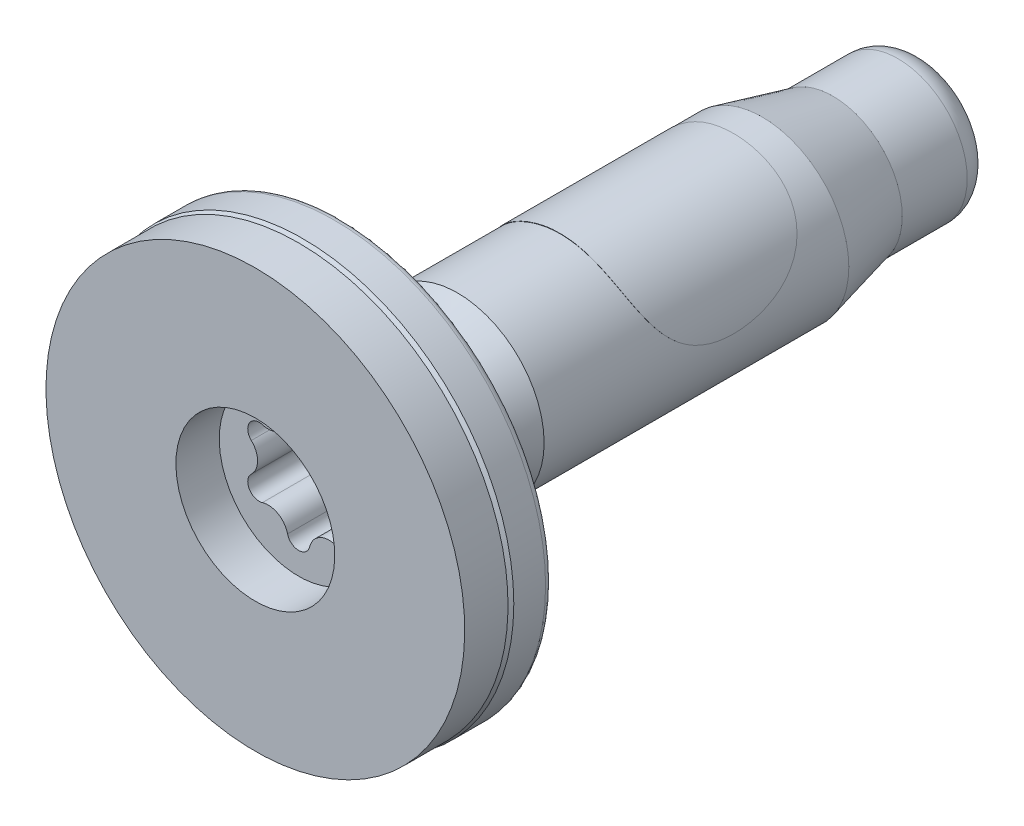
from build123d import *
from build123d.topology import SkipClean

# Parameters (mm, degrees)
SOCKET_CUT_EXTRUDE1_START           = -3.54
SOCKET_CUT_EXTRUDE1_DEPTH           = 3.54
SKETCH13_R                          = 3
LENGTH_BOSS_EXTRUDE1_DEPTH          = 17
SKETCH21_R                          = 2.4
MATPOINT_BOSS_EXTRUDE1_DEPTH        = 3
HEAD_REMOVE_START                   = -4.4
SKETCH59_R                          = 5.5
HEAD_REMOVE_DEPTH                   = 4.4
SMALL_6_LOBE_CUT_START              = -2.55
SMALL_6_LOBE_CUT_DEPTH              = 2.55
F_180_PATCH_EXTRUDE_DEPTH           = 4.5
F_180_PATCH_EXTRUDE_DEPTH_BACK      = 4.5
SKETCH66_R                          = 3
F_180_PATCH_CUT_EXTRUDE_START       = -9.450000865
F_180_PATCH_CUT_EXTRUDE_OUTLINE_R   = 9
F_180_PATCH_CUT_EXTRUDE_OUTLINE_R_2 = 3.010000015
F_180_PATCH_CUT_EXTRUDE_DEPTH       = 6.000000865
SKETCH71_W                          = 1.5
SKETCH71_H                          = 4.5


# Read off the part's stored shape, not the designer's step: 180-patch-Cut-Extrude
with BuildPart() as part:
    # Sketch8 → Head-Revolve1 (revolve)
    with BuildSketch(Plane(origin=(0, 0, 0), x_dir=(0, 0, -1), z_dir=(1, 0, 0))):
        with BuildLine():
            Line((-4.4, 4.75), (-4.4, 2.8))
            Line((-4.4, 2.8), (-4.189927833, 2.016))
            Line((-4.189927833, 2.016), (-4.189927833, 0))
            Line((-4.189927833, 0), (0, 0))
            Line((0, 0), (0, 5))
            Line((0, 5), (-4.15, 5))
            ThreePointArc((-4.15, 5), (-4.326776695, 4.926776695), (-4.4, 4.75))
        make_face()
    revolve(axis=Axis((0, 0, 0), (0, 0, 1)))

    # Sketch9 → socket-Cut-Extrude1 (cut)
    with BuildSketch(Plane.XY.offset(4.4).offset(SOCKET_CUT_EXTRUDE1_START)):
        with BuildLine():
            ThreePointArc((0.544244974, 2.369331508), (1.008, 1.745907214), (1.779778789, 1.655995727))
            ThreePointArc((1.779778789, 1.655995727), (2.424871131, 1.4), (2.324023763, 0.713335781))
            ThreePointArc((2.324023763, 0.713335781), (2.016, 0), (2.324023763, -0.713335781))
            ThreePointArc((2.324023763, -0.713335781), (2.424871131, -1.4), (1.779778789, -1.655995727))
            ThreePointArc((1.779778789, -1.655995727), (1.008, -1.745907214), (0.544244974, -2.369331508))
            ThreePointArc((0.544244974, -2.369331508), (0, -2.8), (-0.544244974, -2.369331508))
            ThreePointArc((-0.544244974, -2.369331508), (-1.008, -1.745907214), (-1.779778789, -1.655995727))
            ThreePointArc((-1.779778789, -1.655995727), (-2.424871131, -1.4), (-2.324023763, -0.713335781))
            ThreePointArc((-2.324023763, -0.713335781), (-2.016, 0), (-2.324023763, 0.713335781))
            ThreePointArc((-2.324023763, 0.713335781), (-2.424871131, 1.4), (-1.779778789, 1.655995727))
            ThreePointArc((-1.779778789, 1.655995727), (-1.008, 1.745907214), (-0.544244974, 2.369331508))
            ThreePointArc((-0.544244974, 2.369331508), (0, 2.8), (0.544244974, 2.369331508))
        make_face()
    extrude(amount=SOCKET_CUT_EXTRUDE1_DEPTH, mode=Mode.SUBTRACT)

    # Sketch12 → Socket-Revolve2 (revolve)
    with BuildSketch(Plane(origin=(0, 0, 0), x_dir=(0, 0, -1), z_dir=(1, 0, 0)), mode=Mode.PRIVATE) as socket_revolve2_sk:
        Polygon((-2.11, 5), (-2.11, 2.8), (-0.86, 0), (0, 0), (0, 5), align=None)
    revolve(socket_revolve2_sk.sketch.rotate(Axis((0, 0, 0), (0, 0, -1)), 90), axis=Axis((0, 0, 0), (0, 0, -1)))

    # Sketch13 → Length-Boss-Extrude1 (add)
    with BuildSketch(Plane.XY):
        Circle(SKETCH13_R)
    extrude(amount=-LENGTH_BOSS_EXTRUDE1_DEPTH)

    # Sketch14 → Runout-Cut-Revolve1 (revolve, cut)
    with BuildSketch(Plane(origin=(0, 0, 0), x_dir=(0, 0, -1), z_dir=(1, 0, 0)), mode=Mode.PRIVATE) as runout_cut_revolve1_sk:
        Polygon((0, 3), (4, 3), (3, 2.675), (0, 2.675), align=None)
    revolve(runout_cut_revolve1_sk.sketch.rotate(Axis((0, 0, 0), (0, 0, -1)), 90), axis=Axis((0, 0, 0), (0, 0, -1)), mode=Mode.SUBTRACT)

    # Sketch15 → Fillet-Revolve3 (revolve)
    with BuildSketch(Plane(origin=(0, 0, 0), x_dir=(0, 0, -1), z_dir=(1, 0, 0)), mode=Mode.PRIVATE) as fillet_revolve3_sk:
        with BuildLine():
            ThreePointArc((0.146390721, 3.0375), (0.536304234, 2.769379359), (1, 2.675))
            Line((1, 2.675), (0, 2.675))
            Line((0, 2.675), (0, 3.4))
            ThreePointArc((0, 3.4), (0.037979272, 3.204528459), (0.146390721, 3.0375))
        make_face()
    revolve(fillet_revolve3_sk.sketch.rotate(Axis((0, 0, 0), (0, 0, -1)), 90), axis=Axis((0, 0, 0), (0, 0, -1)))

    # Sketch16 → Chamfer-Cut-Revolve2 (revolve, cut)
    with BuildSketch(Plane(origin=(0, 0, 0), x_dir=(0, 0, -1), z_dir=(1, 0, 0)), mode=Mode.PRIVATE) as chamfer_cut_revolve2_sk:
        Polygon((17, 3), (16.284947844, 3), (17, 2.4), align=None)
    revolve(chamfer_cut_revolve2_sk.sketch.rotate(Axis((0, 0, 0), (0, 0, -1)), 90), axis=Axis((0, 0, 0), (0, 0, -1)), mode=Mode.SUBTRACT)

    # Sketch21 → matpoint-Boss-Extrude1 (add)
    with BuildSketch(Plane(origin=(0, 0, -17), x_dir=(-1, 0, 0), z_dir=(0, 0, -1))):
        Circle(SKETCH21_R)
    extrude(amount=MATPOINT_BOSS_EXTRUDE1_DEPTH)

    # Sketch22 → matpoint-Cut-Revolve1 (revolve, cut)
    with BuildSketch(Plane(origin=(0, 0, 0), x_dir=(0, 0, -1), z_dir=(1, 0, 0)), mode=Mode.PRIVATE) as matpoint_cut_revolve1_sk:
        with BuildLine():
            Line((20, 2.4), (20, 2))
            ThreePointArc((20, 2), (19.675, 2.29375), (19.25, 2.4))
            Line((19.25, 2.4), (20, 2.4))
        make_face()
        Polygon((17, 3), (14.55, 3), (17, 2.4), align=None)
    revolve(matpoint_cut_revolve1_sk.sketch.rotate(Axis((0, 0, -17), (0, 0, -1)), 90), axis=Axis((0, 0, -17), (0, 0, -1)), mode=Mode.SUBTRACT)

    # Sketch59 → head-remove (cut)
    with BuildSketch(Plane.XY.offset(4.4).offset(HEAD_REMOVE_START)):
        Circle(SKETCH59_R)
    extrude(amount=HEAD_REMOVE_DEPTH, mode=Mode.SUBTRACT)

    # Sketch60 → low-head-Revolve (revolve)
    with BuildSketch(Plane(origin=(0, 0, 0), x_dir=(0, 0, -1), z_dir=(1, 0, 0)), mode=Mode.PRIVATE) as low_head_revolve_sk:
        with BuildLine():
            Line((-1.5, 0), (0, 0))
            Line((0, 0), (0, 7.05))
            ThreePointArc((0, 7.05), (-0.073223305, 7.226776695), (-0.25, 7.3))
            Line((-0.25, 7.3), (-1.35, 7.3))
            Line((-1.35, 7.3), (-1.5, 7.15))
            Line((-1.5, 7.15), (-1.5, 0))
        make_face()
    revolve(low_head_revolve_sk.sketch.rotate(Axis((0, 0, 0), (0, 0, -1)), 90), axis=Axis((0, 0, 0), (0, 0, -1)))

    # Sketch61 → Small-6-lobe-Cut (cut)
    with BuildSketch(Plane.XY.offset(1.5).offset(SMALL_6_LOBE_CUT_START)):
        with BuildLine():
            ThreePointArc((0.38388708, 1.671224903), (0, 1.975), (-0.38388708, 1.671224903))
            ThreePointArc((-0.38388708, 1.671224903), (-0.711, 1.231488124), (-1.255379682, 1.168068415))
            ThreePointArc((-1.255379682, 1.168068415), (-1.710400172, 0.9875), (-1.639266761, 0.503156488))
            ThreePointArc((-1.639266761, 0.503156488), (-1.422, 0), (-1.639266761, -0.503156488))
            ThreePointArc((-1.639266761, -0.503156488), (-1.710400172, -0.9875), (-1.255379682, -1.168068415))
            ThreePointArc((-1.255379682, -1.168068415), (-0.711, -1.231488124), (-0.38388708, -1.671224903))
            ThreePointArc((-0.38388708, -1.671224903), (0, -1.975), (0.38388708, -1.671224903))
            ThreePointArc((0.38388708, -1.671224903), (0.711, -1.231488124), (1.255379682, -1.168068415))
            ThreePointArc((1.255379682, -1.168068415), (1.710400172, -0.9875), (1.639266761, -0.503156488))
            ThreePointArc((1.639266761, -0.503156488), (1.422, 0), (1.639266761, 0.503156488))
            ThreePointArc((1.639266761, 0.503156488), (1.710400172, 0.9875), (1.255379682, 1.168068415))
            ThreePointArc((1.255379682, 1.168068415), (0.711, 1.231488124), (0.38388708, 1.671224903))
        make_face()
    extrude(amount=SMALL_6_LOBE_CUT_DEPTH, mode=Mode.SUBTRACT)

    # Sketch62 → Socket-bottom-Revolve (revolve)
    with BuildSketch(Plane(origin=(0, 0, 0), x_dir=(0, 0, -1), z_dir=(1, 0, 0)), mode=Mode.PRIVATE) as socket_bottom_revolve_sk:
        Polygon((0.6, 1.975), (1.05, 0), (1.1, 0), (1.1, 2.075), (0.6, 2.075), align=None)
    revolve(socket_bottom_revolve_sk.sketch.rotate(Axis((0, 0, -1.05), (0, 0, 1)), 270), axis=Axis((0, 0, -1.05), (0, 0, 1)))

    # Sketch66 → 180-patch-extrude (add, two sides: drawn at the far end of the back side and taken through both)
    with BuildSketch(Plane(origin=(0, 0, 0), x_dir=(0, 0, -1), z_dir=(1, 0, 0)).offset(-F_180_PATCH_EXTRUDE_DEPTH_BACK)):
        with Locations(Location((10.55, 3, 0), (0, 0, 180))):
            Circle(SKETCH66_R)
    extrude(amount=F_180_PATCH_EXTRUDE_DEPTH + F_180_PATCH_EXTRUDE_DEPTH_BACK)

    # 180-patch-Cut-Extrude outline → 180-patch-Cut-Extrude (cut)
    with SkipClean():  # the faces are left unmerged after this step: merging them gives an invalid solid
        with BuildSketch(Plane(origin=(0, 0, -17), x_dir=(-1, 0, 0), z_dir=(0, 0, -1)).offset(F_180_PATCH_CUT_EXTRUDE_START)):
            Circle(F_180_PATCH_CUT_EXTRUDE_OUTLINE_R)
            with Locations((-1.5e-08, 0)):
                Circle(F_180_PATCH_CUT_EXTRUDE_OUTLINE_R_2, mode=Mode.SUBTRACT)
        extrude(amount=F_180_PATCH_CUT_EXTRUDE_DEPTH, mode=Mode.SUBTRACT)


with BuildPart() as body_2:
    # Sketch71 → Revolve1 (revolve)
    with BuildSketch(Plane(origin=(0, 0, 0), x_dir=(0, 0, -1), z_dir=(1, 0, 0))):
        with Locations((-2.25, 5)):
            Rectangle(SKETCH71_W, SKETCH71_H)
    revolve(axis=Axis((0, 0, 1.5), (0, 0, 1)))


solid = Compound([part.part, body_2.part])
